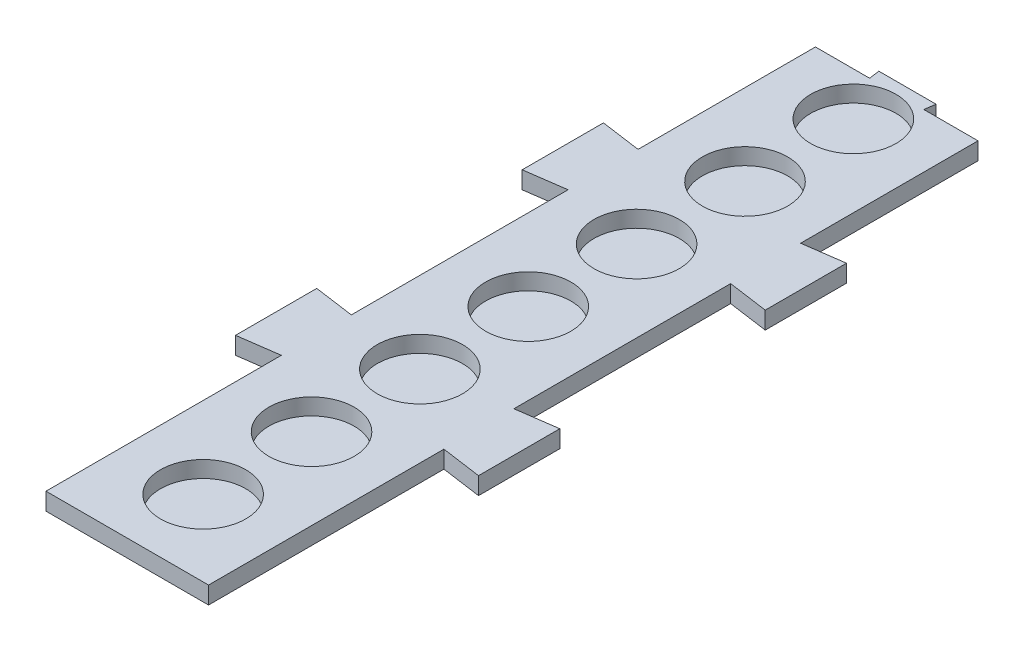
from build123d import *

# Parameters (mm, degrees)
SKETCH1_W           = 38.1
SKETCH1_H           = 391.16
BOSS_EXTRUDE1_DEPTH = 4.064
SKETCH2_R           = 10
CUT_EXTRUDE1_DEPTH  = 3.863999892
BOSS_EXTRUDE2_DEPTH = 4.064
SKETCH7_W           = 56.96460671
SKETCH7_H           = 4.064
CUT_EXTRUDE2_DEPTH  = 210.82
BOSS_EXTRUDE4_DEPTH = 4.064
SKETCH9_R           = 1.27
CUT_EXTRUDE3_DEPTH  = 12.7


with BuildPart() as part:
    # Sketch1 → Boss-Extrude1 (new body)
    with BuildSketch(Plane(origin=(0, 0, 0), x_dir=(1, 0, 0), z_dir=(0, 1, 0))):
        Rectangle(SKETCH1_W, SKETCH1_H)
    extrude(amount=BOSS_EXTRUDE1_DEPTH)

    # Sketch2 → Cut-Extrude1 (cut)
    with BuildSketch(Plane(origin=(0, 4.064, 0), x_dir=(1, 0, 0), z_dir=(0, 1, 0))):
        with Locations((0, 177.8)):
            Circle(SKETCH2_R)
        with Locations((0, 152.4)):
            Circle(SKETCH2_R)
        with Locations((0, 127)):
            Circle(SKETCH2_R)
        with Locations((0, 101.6)):
            Circle(SKETCH2_R)
        with Locations((0, 76.2)):
            Circle(SKETCH2_R)
        with Locations((0, 50.8)):
            Circle(SKETCH2_R)
        with Locations((0, 25.4)):
            Circle(SKETCH2_R)
        Circle(SKETCH2_R)
        with Locations((0, -25.4)):
            Circle(SKETCH2_R)
        with Locations((0, -50.8)):
            Circle(SKETCH2_R)
        with Locations((0, -76.2)):
            Circle(SKETCH2_R)
        with Locations((0, -101.6)):
            Circle(SKETCH2_R)
        with Locations((0, -127)):
            Circle(SKETCH2_R)
        with Locations((0, -152.4)):
            Circle(SKETCH2_R)
        with Locations((0, -177.8)):
            Circle(SKETCH2_R)
    extrude(amount=-CUT_EXTRUDE1_DEPTH, mode=Mode.SUBTRACT)

    # Sketch4 → Boss-Extrude2 (add)
    with BuildSketch(Plane(origin=(0, 0, 0), x_dir=(1, 0, 0), z_dir=(0, 1, 0))):
        Polygon((28.482303355, -55.490633493), (19.05, -56.81625728), (19.05, -73.215009707), (28.482303355, -74.540633493), align=None)
        Polygon((28.482303355, 146.105623787), (19.05, 144.78), (19.05, 128.381247573), (28.482303355, 127.055623787), align=None)
        Polygon((-19.05, 128.381247573), (-19.05, 144.78), (-28.482303355, 146.105623787), (-28.482303355, 127.055623787), align=None)
        Polygon((28.482303355, 78.90687136), (19.05, 77.581247573), (19.05, 61.182495147), (28.482303355, 59.85687136), align=None)
        Polygon((28.482303355, 11.708118933), (19.05, 10.382495147), (19.05, -6.01625728), (28.482303355, -7.341881067), align=None)
        Polygon((-19.05, -6.01625728), (-19.05, 10.382495147), (-28.482303355, 11.708118933), (-28.482303355, -7.341881067), align=None)
        Polygon((-19.05, 61.182495147), (-19.05, 77.581247573), (-28.482303355, 78.90687136), (-28.482303355, 59.85687136), align=None)
        Polygon((28.482303355, -122.68938592), (19.05, -124.015009707), (19.05, -140.413762134), (28.482303355, -141.73938592), align=None)
        Polygon((-19.05, -140.413762134), (-19.05, -124.015009707), (-28.482303355, -122.68938592), (-28.482303355, -141.73938592), align=None)
        Polygon((-19.05, -73.215009707), (-19.05, -56.81625728), (-28.482303355, -55.490633493), (-28.482303355, -74.540633493), align=None)
    extrude(amount=BOSS_EXTRUDE2_DEPTH)

    # Sketch7 → Cut-Extrude2 (cut)
    with BuildSketch(Plane(origin=(0, 0, -195.58), x_dir=(-1, 0, 0), z_dir=(0, 0, -1))):
        with Locations((0, 2.032)):
            Rectangle(SKETCH7_W, SKETCH7_H)
    extrude(amount=-CUT_EXTRUDE2_DEPTH, mode=Mode.SUBTRACT)

    # Sketch8 → Boss-Extrude4 (add)
    with BuildSketch(Plane(origin=(0, 4.064, 0), x_dir=(1, 0, 0), z_dir=(0, 1, 0))):
        Polygon((-6.35, -15.24), (-6.703499676, -12.724719105), (6.703499676, -12.724719105), (6.35, -15.24), align=None)
    extrude(amount=-BOSS_EXTRUDE4_DEPTH)

    # Sketch9 → Cut-Extrude3 (cut)
    with BuildSketch(Plane(origin=(0, 0, 15.24), x_dir=(-1, 0, 0), z_dir=(0, 0, -1))):
        with Locations((12.607303355, 2.032)):
            Circle(SKETCH9_R)
        with Locations((-12.607303355, 2.032)):
            Circle(SKETCH9_R)
    extrude(amount=-CUT_EXTRUDE3_DEPTH, mode=Mode.SUBTRACT)


solid = part.part
